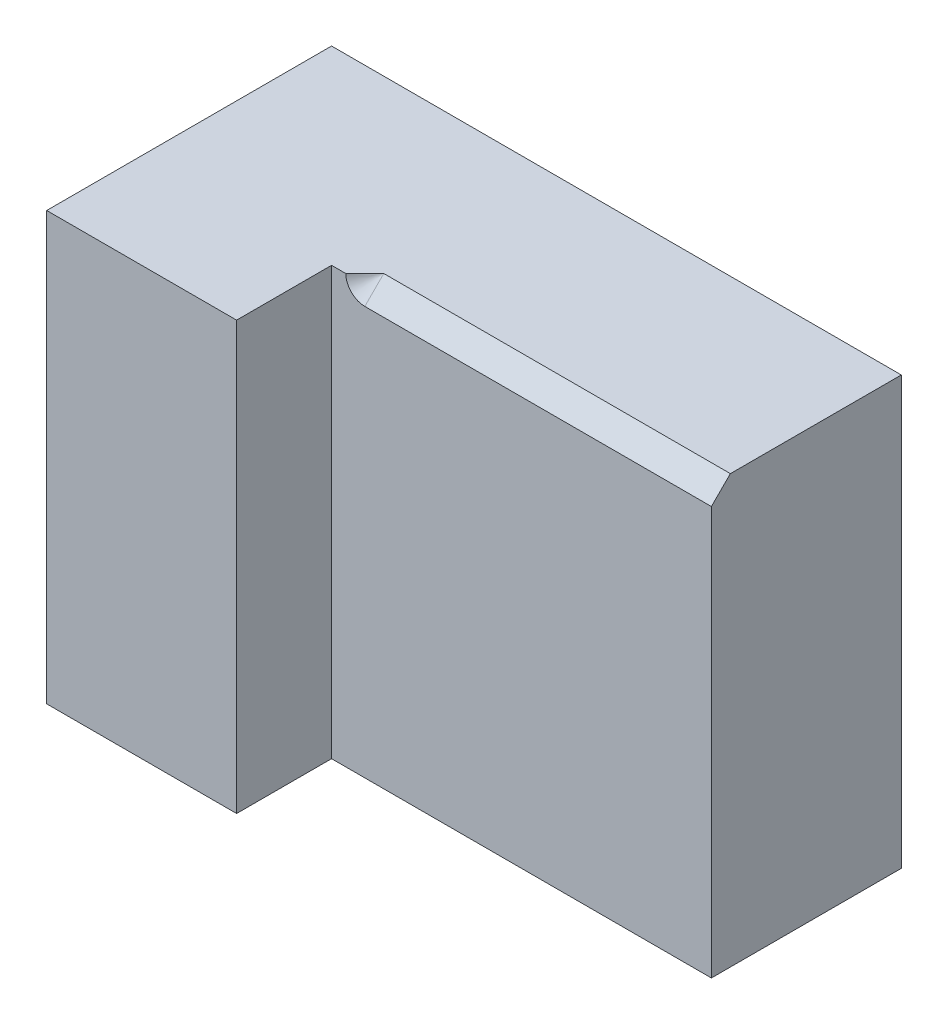
from build123d import *

# Parameters (mm, degrees)
SKETCH1_W               = 60
SKETCH1_H               = 45
BOSS_EXTRUDE1_DEPTH     = 20
SKETCH2_W               = 20
SKETCH2_H               = 45
BOSS_EXTRUDE2_DEPTH     = 10
MFGCHAMFER1_START       = 28.637824638
MFGCHAMFER1_2_OUTLINE_W = 36.5
MFGCHAMFER1_2_OUTLINE_H = 2.828427124
MFGCHAMFER1_2_DEPTH     = 2.362175362


with BuildPart() as part:
    # Sketch1 → Boss-Extrude1 (new body)
    with BuildSketch(Plane.XY):
        Rectangle(SKETCH1_W, SKETCH1_H)
    extrude(amount=BOSS_EXTRUDE1_DEPTH)

    # Sketch2 → Boss-Extrude2 (add)
    with BuildSketch(Plane.XY.offset(20)):
        with Locations((-20, 0)):
            Rectangle(SKETCH2_W, SKETCH2_H)
    extrude(amount=BOSS_EXTRUDE2_DEPTH)

    # MfgChamfer1: read off the stored shape, not the designer's step
    # MfgChamfer1 outline → MfgChamfer1 (revolve, cut)
    with BuildSketch(Plane(origin=(-6.5, 22.5, 0), x_dir=(1, 0, 0), z_dir=(0, -1, 0))):
        Polygon((0, 20), (0, 18), (2, 20), align=None)
    revolve(axis=Axis((-6.5, 22.5, 0), (0, 0, 1)), mode=Mode.SUBTRACT)

    # MfgChamfer1 2 outline → MfgChamfer1 2 (cut)
    with BuildSketch(Plane(origin=(0, 0, 0), x_dir=(1, 0, 0), z_dir=(0, 0.707106781186547, 0.707106781186548)).offset(MFGCHAMFER1_START)):
        with Locations((11.75, 1.767766953)):
            Rectangle(MFGCHAMFER1_2_OUTLINE_W, MFGCHAMFER1_2_OUTLINE_H)
    extrude(amount=MFGCHAMFER1_2_DEPTH, mode=Mode.SUBTRACT)


solid = part.part
